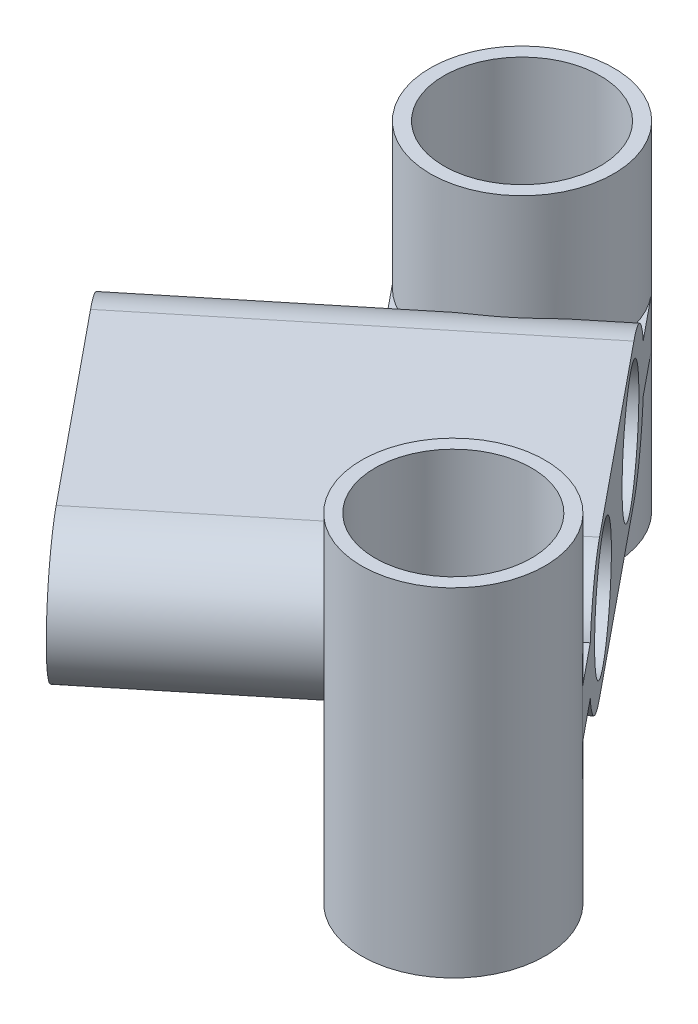
from build123d import *
from build123d.topology import SkipClean

# Parameters (mm, degrees)
BOSS_EXTRUDE2_DEPTH      = 5
BOSS_EXTRUDE3_DEPTH      = 15
BOSS_EXTRUDE3_DEPTH_BACK = 20
SKETCH4_R                = 9.5
SKETCH4_R_2              = 8.1
BOSS_EXTRUDE4_DEPTH      = 21
BOSS_EXTRUDE4_DEPTH_BACK = 19
SKETCH5_R                = 6.1
CUT_EXTRUDE2_START       = -41
SKETCH6_R                = 6.1
CUT_EXTRUDE2_DEPTH       = 41


with BuildPart() as part:
    # Sketch3 → Boss-Extrude2 (new body)
    with BuildSketch(Plane(origin=(0, 0, 0), x_dir=(1, 0, 0), z_dir=(0, 1, 0))):
        with BuildLine():
            Line((-3.174904091, 31.814719718), (28.442244127, -6.919708618))
            ThreePointArc((28.442244127, -6.919708618), (27.089960905, -20.286508163), (13.723161359, -18.934224941))
            Line((13.723161359, -18.934224941), (-17.893986859, 19.800203396))
            ThreePointArc((-17.893986859, 19.800203396), (-16.541703636, 33.167002941), (-3.174904091, 31.814719718))
        make_face()
    extrude(amount=BOSS_EXTRUDE2_DEPTH)

    # Sketch4 → Boss-Extrude3 (add, two sides: drawn at the far end of the back side and taken through both)
    # profile 1 of 2: a face of its own
    with SkipClean():  # the faces are left unmerged after this step: merging them gives an invalid solid
        with BuildSketch(Plane(origin=(0, 5, 0), x_dir=(1, 0, 0), z_dir=(0, 1, 0)).offset(-BOSS_EXTRUDE3_DEPTH_BACK)):
            with Locations((-10.534445475, 25.807461557)):
                Circle(SKETCH4_R)
            with Locations((-10.534445475, 25.807461557)):
                Circle(SKETCH4_R_2, mode=Mode.SUBTRACT)
        # profile 2 of 2: a face of its own
        with BuildSketch(Plane(origin=(0, 5, 0), x_dir=(1, 0, 0), z_dir=(0, 1, 0)).offset(-BOSS_EXTRUDE3_DEPTH_BACK)):
            with Locations((21.082702743, -12.92696678)):
                Circle(SKETCH4_R)
            with Locations((21.082702743, -12.92696678)):
                Circle(SKETCH4_R_2, mode=Mode.SUBTRACT)
        extrude(amount=BOSS_EXTRUDE3_DEPTH + BOSS_EXTRUDE3_DEPTH_BACK)

    # Sketch5 → Boss-Extrude4 (add, two sides: drawn at the far end of the back side and taken through both)
    with SkipClean():  # the faces are left unmerged after this step: merging them gives an invalid solid
        with BuildSketch(Plane(origin=(-1.03943662, 0, 0.848444732), x_dir=(0.6323429643622943, 0, 0.774688566729564), z_dir=(-0.774688566729564, 0, 0.6323429643622943)).offset(-BOSS_EXTRUDE4_DEPTH_BACK)):
            with BuildLine():
                Line((-14.154127884, 9.71687123), (10.845872116, 9.71687123))
                ThreePointArc((10.845872116, 9.71687123), (18.062743346, 2.5), (10.845872116, -4.71687123))
                Line((10.845872116, -4.71687123), (-14.154127884, -4.71687123))
                ThreePointArc((-14.154127884, -4.71687123), (-21.370999114, 2.5), (-14.154127884, 9.71687123))
            make_face()
            with Locations((-11.654127884, 2.5)):
                Circle(SKETCH5_R, mode=Mode.SUBTRACT)
            with Locations((8.345872116, 2.5)):
                Circle(SKETCH5_R, mode=Mode.SUBTRACT)
        extrude(amount=BOSS_EXTRUDE4_DEPTH + BOSS_EXTRUDE4_DEPTH_BACK)

    # Sketch6 → Cut-Extrude2 (cut)
    with SkipClean():  # the faces are left unmerged after this step: merging them gives an invalid solid
        with BuildSketch(Plane(origin=(-17.307896522, 0, 14.127646984), x_dir=(0.6323429643622943, 0, 0.774688566729564), z_dir=(-0.774688566729564, 0, 0.6323429643622943)).offset(CUT_EXTRUDE2_START)):
            with Locations((-11.654127884, 2.5)):
                Circle(SKETCH6_R)
            with Locations((8.345872116, 2.5)):
                Circle(SKETCH6_R)
        extrude(amount=CUT_EXTRUDE2_DEPTH, mode=Mode.SUBTRACT)


solid = part.part
